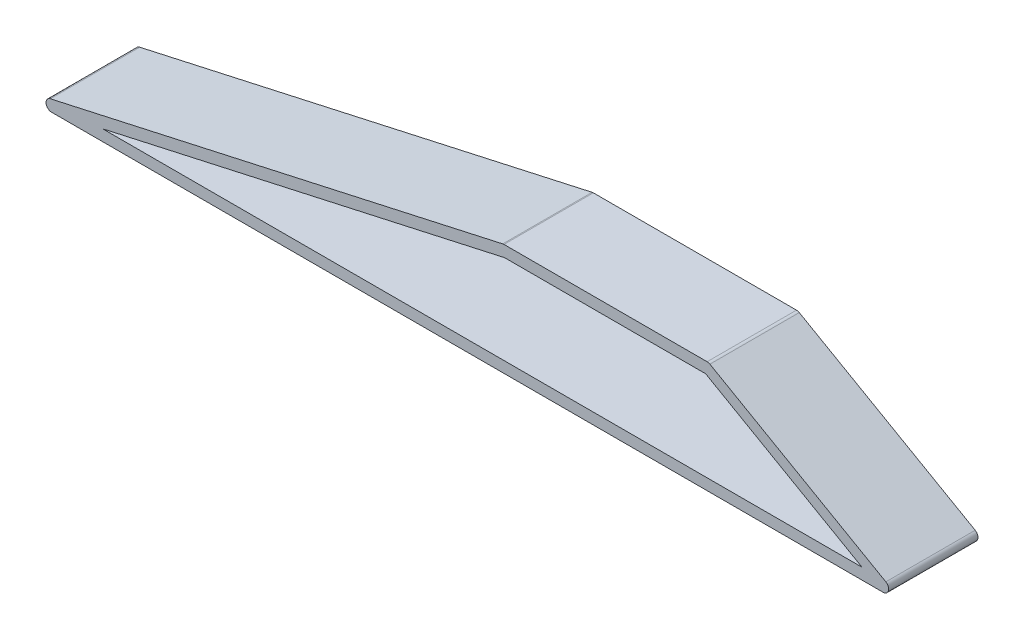
from build123d import *

# Parameters (mm, degrees)
BOSS_EXTRUDE1_DEPTH = 25.4
FILLET1_R           = 1.5875


with BuildPart() as part:
    # Sketch1 → Boss-Extrude1 (new body)
    with BuildSketch(Plane.XY):
        Polygon((113.951473174, 28.575), (-28.923526826, -3.175), (227.855667088, -3.175), (172.293167088, 28.575), align=None)
        Polygon((0, 0), (215.9, 0), (171.45, 25.4), (114.3, 25.4), align=None, mode=Mode.SUBTRACT)
    extrude(amount=BOSS_EXTRUDE1_DEPTH)

    # Fillet1
    fillet1_edges = [part.edges().sort_by_distance(p)[0] for p in [
        (-28.923526826, -3.175, 12.7),
        (113.951473174, 28.575, 12.7),
        (172.293167088, 28.575, 12.7),
        (227.855667088, -3.175, 12.7),
    ]]
    fillet(fillet1_edges, radius=FILLET1_R)


solid = part.part
